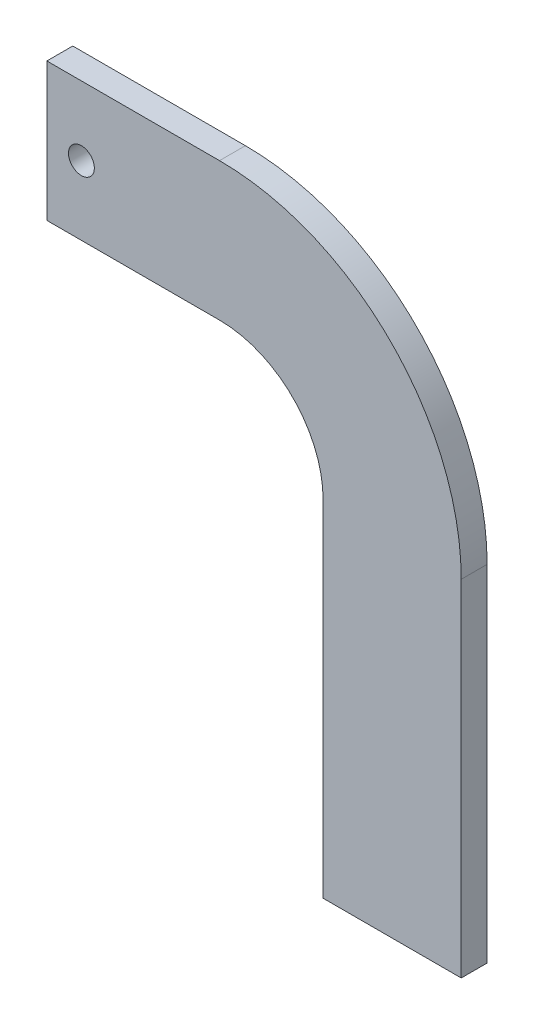
from build123d import *

# Parameters (mm, degrees)
SKETCH3_R      = 9.525
EXTRUDE1_DEPTH = 19.05


with BuildPart() as part:
    # Sketch3 → Extrude1 (new body)
    with BuildSketch(Plane.XY):
        with BuildLine():
            Line((0, 0), (101.6, 0))
            Line((101.6, 0), (101.6, 254))
            ThreePointArc((101.6, 254), (49.523585695, 379.723585695), (-76.2, 431.8))
            Line((-76.2, 431.8), (-203.2, 431.8))
            Line((-203.2, 431.8), (-203.2, 330.2))
            Line((-203.2, 330.2), (-76.2, 330.2))
            ThreePointArc((-76.2, 330.2), (-22.318463274, 307.881536726), (0, 254))
            Line((0, 254), (0, 0))
        make_face()
        with Locations((-177.8, 381)):
            Circle(SKETCH3_R, mode=Mode.SUBTRACT)
    extrude(amount=EXTRUDE1_DEPTH)


solid = part.part
